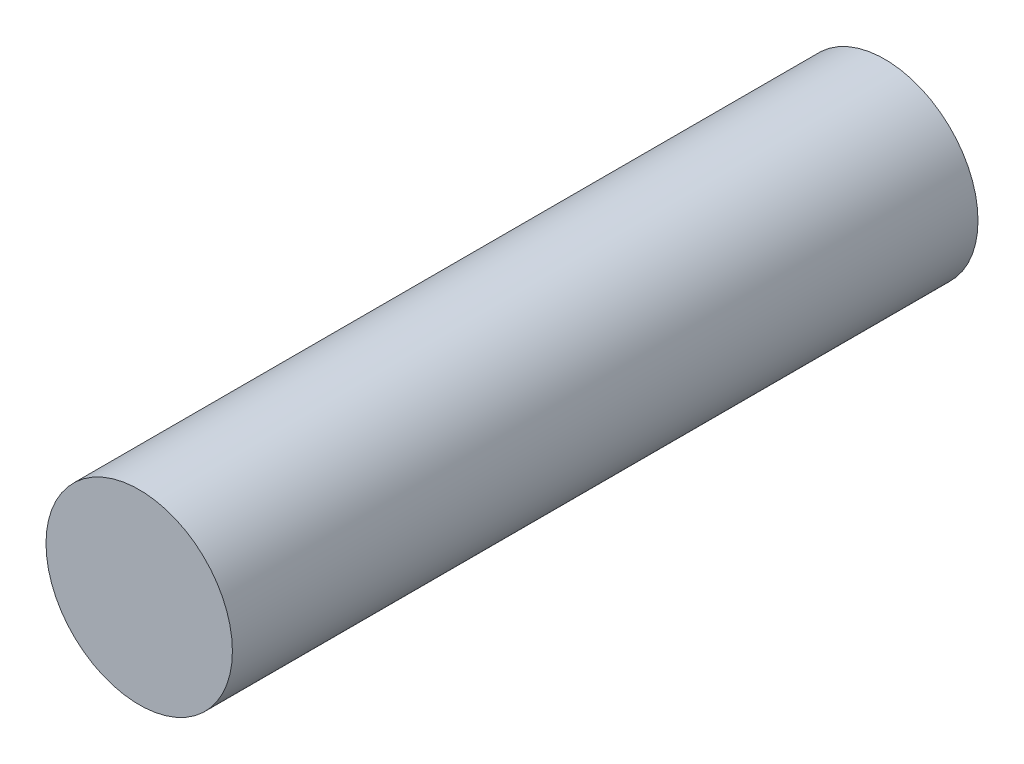
from build123d import *

# Parameters (mm, degrees)
ESBO_O1_R                = 0.75
RESSALTO_EXTRUS_O1_DEPTH = 6


with BuildPart() as part:
    # Esboço1 → Ressalto-extrusão1 (new body)
    with BuildSketch(Plane.XY):
        Circle(ESBO_O1_R)
    extrude(amount=RESSALTO_EXTRUS_O1_DEPTH)


solid = part.part
